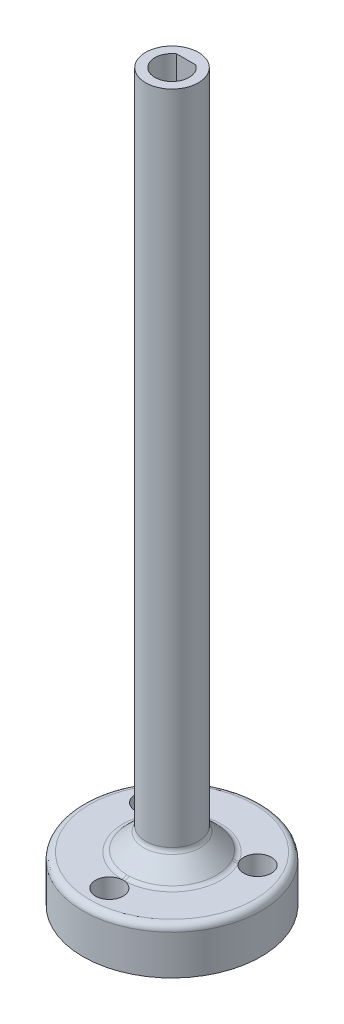
from build123d import *

# Parameters (mm, degrees)
SKETCH1_R           = 13.5
SKETCH1_R_2         = 2.1
BOSS_EXTRUDE1_DEPTH = 7
BOSS_EXTRUDE2_START = 7
SKETCH1_3_R         = 4
BOSS_EXTRUDE2_DEPTH = 103
CUT_EXTRUDE1_DEPTH  = 17
CHAMFER1_SIZE       = 3
FILLET3_R           = 1
CHAMFER2_SIZE       = 2


with BuildPart() as part:
    # Sketch1 → Boss-Extrude1 (new body)
    with BuildSketch(Plane(origin=(0, 0, 0), x_dir=(1, 0, 0), z_dir=(0, 1, 0))):
        with Locations(Location((0, 0, 0), (0, 0, 270))):
            Circle(SKETCH1_R)
        with Locations(Location((0, -9.5, 0), (0, 0, 270))):
            Circle(SKETCH1_R_2, mode=Mode.SUBTRACT)
        with Locations(Location((-8.227241336, 4.75, 0), (0, 0, 270))):
            Circle(SKETCH1_R_2, mode=Mode.SUBTRACT)
        with Locations(Location((8.227241336, 4.75, 0), (0, 0, 270))):
            Circle(SKETCH1_R_2, mode=Mode.SUBTRACT)
    extrude(amount=BOSS_EXTRUDE1_DEPTH)

    # Sketch1<3> → Boss-Extrude2 (add)
    with BuildSketch(Plane(origin=(0, 0, 0), x_dir=(1, 0, 0), z_dir=(0, 1, 0)).offset(BOSS_EXTRUDE2_START)):
        with Locations(Location((0, 0, 0), (0, 0, 270))):
            Circle(SKETCH1_3_R)
    extrude(amount=BOSS_EXTRUDE2_DEPTH)

    # Sketch2 → Cut-Extrude1 (cut)
    with BuildSketch(Plane(origin=(0, 110, 0), x_dir=(1, 0, 0), z_dir=(0, 1, 0))):
        with BuildLine():
            Line((-1.462019152, 2.15), (1.462019152, 2.15))
            ThreePointArc((1.462019152, 2.15), (0, -2.6), (-1.462019152, 2.15))
        make_face()
    extrude(amount=-CUT_EXTRUDE1_DEPTH, mode=Mode.SUBTRACT)

    # Chamfer1
    chamfer1_edges = [part.edges().sort_by_distance(p)[0] for p in [
        (0, 7, -4),
    ]]
    chamfer(chamfer1_edges, length=CHAMFER1_SIZE)

    # Fillet3
    fillet3_edges = [part.edges().sort_by_distance(p)[0] for p in [
        (0, 7, -13.5),
        (0, 10, -4),
        (0, 7, -7),
    ]]
    fillet(fillet3_edges, radius=FILLET3_R)

    # Chamfer2
    # the kernel refuses this chamfer: 2 mm, written as the material it adds along each edge
    with BuildSketch(Plane(origin=(0, 93, 0), x_dir=(0.003141587485879782, 0, -0.9999950652018581), z_dir=(-0.9999950652018581, 0, -0.003141587485879782))) as chamfer2_piece_1:
        Polygon((2.6, -CHAMFER2_SIZE), (2.6 - CHAMFER2_SIZE, 0), (2.6, 0), align=None)
    revolve(axis=Axis((0, 93, 0), (0, -1, 0)), revolution_arc=359.64)
    with BuildSketch(Plane(origin=(-6.605385128, 93, -2.15), x_dir=(0, 0.9996219169112968, -0.0274958766105862), z_dir=(1, 0, 0))) as chamfer2_piece_2_section:
        Polygon((CHAMFER2_SIZE * 0.999621916911, CHAMFER2_SIZE * 0.0274958766106), (-CHAMFER2_SIZE * 0.0274958766106, CHAMFER2_SIZE * 0.999621916911), (0, 0), align=None)
    chamfer2_piece_2 = extrude(amount=13.210770255, mode=Mode.PRIVATE)
    chamfer2_piece_2 = chamfer2_piece_2 & Plane(origin=(0, 93.615158387, 0), x_dir=(0.5623150583543634, 0, -0.826923076923077), z_dir=(0, 1, 0)) * Cylinder(2.6, 35, mode=Mode.PRIVATE)
    add(chamfer2_piece_2)


solid = part.part
